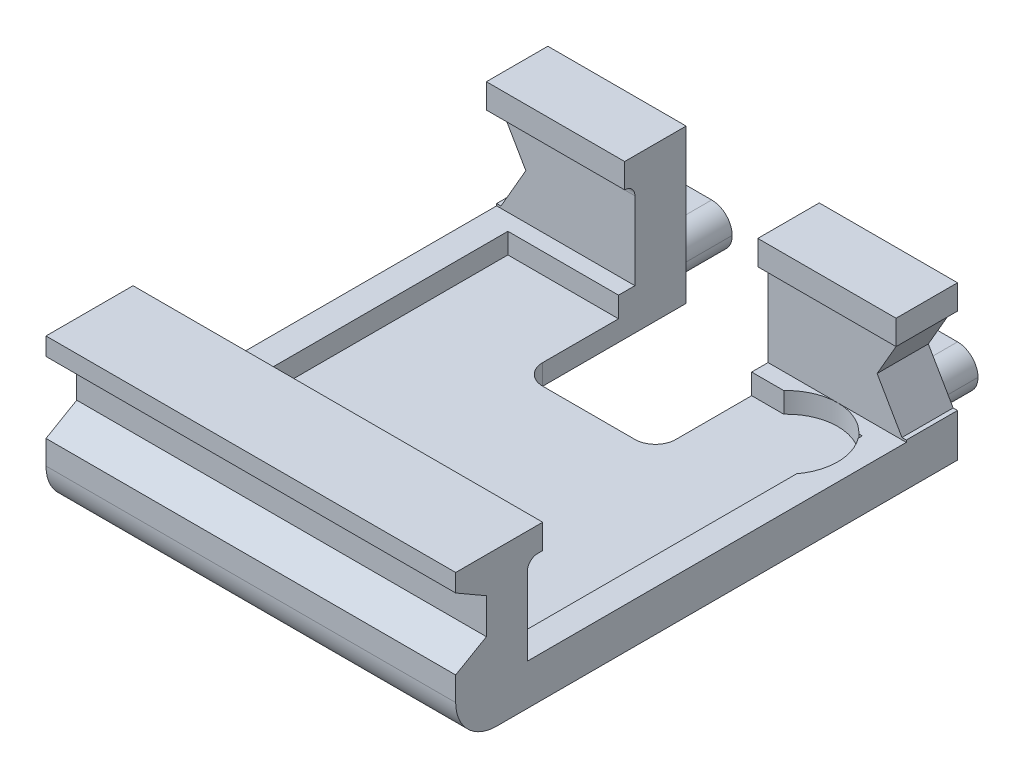
from build123d import *

# Parameters (mm, degrees)
BOSS_EXTRUDE1_DEPTH = 2
FILLET1_R           = 1
SKETCH4_W           = 17.3
SKETCH4_H           = 17.7
CUT_EXTRUDE3_DEPTH  = 1
BOSS_EXTRUDE3_REACH = 26.784
CUT_EXTRUDE5_REACH  = 21.144
SKETCH7_W           = 6.5
SKETCH7_H           = 3
CUT_EXTRUDE6_DEPTH  = 3.5
FILLET3_R           = 0.5
BOSS_EXTRUDE4_DEPTH = 20
SKETCH10_R          = 2.5
CUT_EXTRUDE7_DEPTH  = 1
FILLET4_R           = 2


# Some blends are built 0.0001 mm under size
with BuildPart() as part:
    # Sketch1 → Boss-Extrude1 (new body)
    with BuildSketch(Plane(origin=(0, 0, 0), x_dir=(1, 0, 0), z_dir=(0, 1, 0))):
        Polygon((10, -11.5), (10, 11.5), (8, 11.5), (8, 14.5), (4, 14.5), (4, 11.5), (3.25, 11.5), (3.25, 3.5), (-3.25, 3.5), (-3.25, 11.5), (-4, 11.5), (-4, 14.5), (-8, 14.5), (-8, 11.5), (-10, 11.5), (-10, -11.5), align=None)
    extrude(amount=BOSS_EXTRUDE1_DEPTH)

    # Fillet1
    fillet1_edges = [part.edges().sort_by_distance(p)[0] for p in [
        (-3.25, 1, -3.5),
        (3.25, 1, -3.5),
        (-8, 0, -13),
        (-8, 2, -13),
        (4, 0, -13),
        (4, 2, -13),
        (8, 0, -13),
        (8, 2, -13),
        (-4, 0, -13),
        (-4, 2, -13),
    ]]
    fillet(fillet1_edges, radius=FILLET1_R - 0.0001)  # a hair under: the kernel refuses the full size

    # Sketch4 → Cut-Extrude3 (cut)
    with BuildSketch(Plane(origin=(0, 2, 0), x_dir=(1, 0, 0), z_dir=(0, 1, 0))):
        with Locations((0, -0.65)):
            Rectangle(SKETCH4_W, SKETCH4_H)
    extrude(amount=-CUT_EXTRUDE3_DEPTH, mode=Mode.SUBTRACT)

    # Boss-Extrude3: up to this face of the body (flat: up to its plane)
    boss_extrude3_end = Plane(part.part.faces().sort_by_distance((-10, 1, 0))[0])
    # Sketch5 → Boss-Extrude3 (add, up to the picked face)
    with BuildSketch(Plane(origin=(10, 0, 0), x_dir=(0, 0, -1), z_dir=(1, 0, 0)), mode=Mode.PRIVATE) as boss_extrude3_sk1:
        Polygon((-11.5, 2), (-9.5, 2), (-9.5, 6.3), (-8.75, 6.3), (-8.75, 7.5), (-11.5, 7.5), align=None)
    boss_extrude3_tool1 = split(extrude(boss_extrude3_sk1.sketch, amount=-BOSS_EXTRUDE3_REACH, mode=Mode.PRIVATE), bisect_by=boss_extrude3_end, keep=Keep.BOTH, mode=Mode.PRIVATE)
    # Sketch5 → Boss-Extrude3 (add, up to the picked face)
    with BuildSketch(Plane(origin=(10, 0, 0), x_dir=(0, 0, -1), z_dir=(1, 0, 0)), mode=Mode.PRIVATE) as boss_extrude3_sk2:
        Polygon((9, 2), (11.5, 2), (11.5, 7.5), (8.5, 7.5), (8.5, 6.3), (9, 6.3), align=None)
    boss_extrude3_tool2 = split(extrude(boss_extrude3_sk2.sketch, amount=-BOSS_EXTRUDE3_REACH, mode=Mode.PRIVATE), bisect_by=boss_extrude3_end, keep=Keep.BOTH, mode=Mode.PRIVATE)
    add(boss_extrude3_tool1.solids().sort_by(Axis((10, 4.912605, 10.396008), (-1, 0, 0)))[0])
    add(boss_extrude3_tool2.solids().sort_by(Axis((10, 4.839895, -10.187282), (-1, 0, 0)))[0])

    # Sketch7 → Cut-Extrude5 (cut, up to next)
    with BuildSketch(Plane(origin=(0, 7.5, 0), x_dir=(1, 0, 0), z_dir=(0, 1, 0)), mode=Mode.PRIVATE) as cut_extrude5_sk1:
        with Locations((0, 10)):
            Rectangle(SKETCH7_W, SKETCH7_H)
    cut_extrude5_tool1 = extrude(cut_extrude5_sk1.sketch, amount=-CUT_EXTRUDE5_REACH, mode=Mode.PRIVATE) & part.part
    add(cut_extrude5_tool1.solids().sort_by_distance((0, 7.5, -10))[0], mode=Mode.SUBTRACT)

    # Sketch8 → Cut-Extrude6 (cut)
    with BuildSketch(Plane(origin=(0, 0, -11.5), x_dir=(-1, 0, 0), z_dir=(0, 0, -1))):
        Polygon((-8.575128869, 4.2), (-9.787564435, 6.3), (-12.212435565, 6.3), (-13.424871131, 4.2), (-12.212435565, 2.1), (-9.787564435, 2.1), align=None)
        Polygon((12.212435565, 2.1), (9.787564435, 2.1), (8.575128869, 4.2), (9.787564435, 6.3), (12.212435565, 6.3), (13.424871131, 4.2), align=None)
    extrude(amount=-CUT_EXTRUDE6_DEPTH, mode=Mode.SUBTRACT)

    # Fillet3
    # the kernel refuses this fillet: 0.5 mm, written as the material it adds along each edge
    with BuildSketch(Plane(origin=(10, 6.3, 9.5), x_dir=(0, -1, 0), z_dir=(-1, 0, 0))) as fillet3_piece_1:
        with BuildLine():
            CenterArc((FILLET3_R, -FILLET3_R), FILLET3_R, 90, 90)
            Line((0, -FILLET3_R), (0, 0))
            Line((0, 0), (FILLET3_R, 0))
        make_face()
    extrude(amount=20)
    with BuildSketch(Plane(origin=(11.037564435, 6.3, -9), x_dir=(0, -1, 0), z_dir=(-1, 0, 0))) as fillet3_piece_2_section:
        with BuildLine():
            CenterArc((FILLET3_R, FILLET3_R), FILLET3_R, 180, 90)
            Line((0, FILLET3_R), (0, 0))
            Line((0, 0), (FILLET3_R, 0))
        make_face()
    fillet3_piece_2 = extrude(amount=7.787564435, mode=Mode.PRIVATE)
    fillet3_piece_2 = split(fillet3_piece_2, bisect_by=Plane(origin=(8.913707181, 4.786434839, -8.886190127), z_dir=(-0.8660254037844385, 0.5000000000000003, 0)), keep=Keep.TOP, mode=Mode.PRIVATE)
    add(fillet3_piece_2)
    with BuildSketch(Plane(origin=(-3.25, 6.3, -9), x_dir=(0, -1, 0), z_dir=(-1, 0, 0))) as fillet3_piece_3_section:
        with BuildLine():
            CenterArc((FILLET3_R, FILLET3_R), FILLET3_R, 180, 90)
            Line((0, FILLET3_R), (0, 0))
            Line((0, 0), (FILLET3_R, 0))
        make_face()
    fillet3_piece_3 = extrude(amount=7.787564435, mode=Mode.PRIVATE)
    fillet3_piece_3 = split(fillet3_piece_3, bisect_by=Plane(origin=(-8.913707181, 4.786434839, -8.886190127), z_dir=(0.8660254037844393, 0.49999999999999906, 0)), keep=Keep.TOP, mode=Mode.PRIVATE)
    add(fillet3_piece_3)

    # Sketch9 → Boss-Extrude4 (add)
    with BuildSketch(Plane(origin=(10, 0, 0), x_dir=(0, 0, -1), z_dir=(1, 0, 0))):
        Polygon((-13, 6.632050808), (-11.5, 5.766025404), (-11.5, 7.5), (-13, 7.5), align=None)
        Polygon((-11.5, 0), (-11.5, 4.033974596), (-13, 3.167949192), (-13, 0), align=None)
    extrude(amount=-BOSS_EXTRUDE4_DEPTH)

    # Sketch10 → Cut-Extrude7 (cut)
    with BuildSketch(Plane(origin=(0, 2, 0), x_dir=(1, 0, 0), z_dir=(0, 1, 0))):
        with Locations((6.65, 6.5)):
            Circle(SKETCH10_R)
    extrude(amount=-CUT_EXTRUDE7_DEPTH, mode=Mode.SUBTRACT)

    # Fillet4
    fillet4_edges = [part.edges().sort_by_distance(p)[0] for p in [
        (0, 0, 13),
    ]]
    fillet(fillet4_edges, radius=FILLET4_R)


solid = part.part
